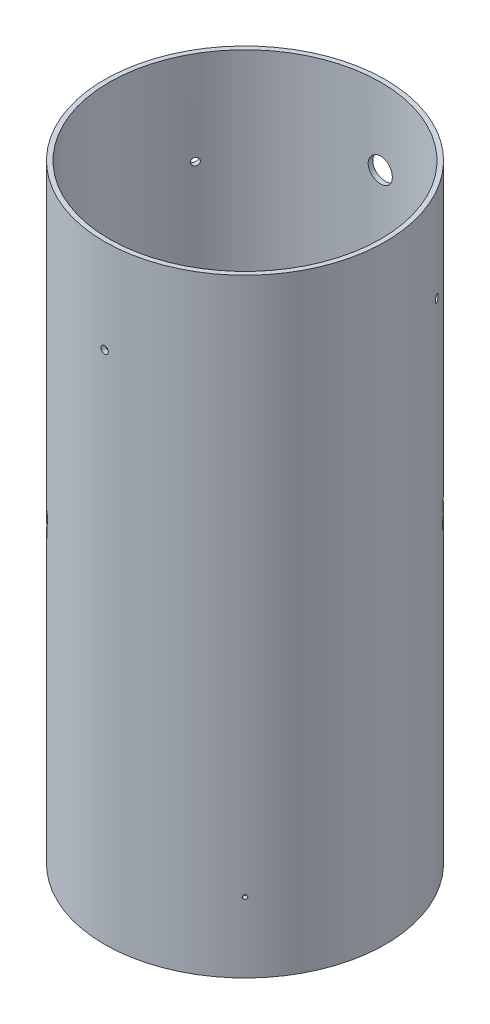
from build123d import *

# Parameters (mm, degrees)
SKETCH1_R                     = 76.1746
SKETCH1_R_2                   = 73.66
BOSS_EXTRUDE1_DEPTH           = 330.2
SKETCH23_R                    = 1.0922
SHEAR_SCRREWS_DEPTH           = 348.328633238
CIRPATTERN1_COUNT             = 4
CIRPATTERN2_COUNT             = 3
SKETCH26_R                    = 2.7499945
SKETCH26_W                    = 6.99999997
SKETCH26_H                    = 10.000000066
UPWARDS_CAMERA_CUTOUT_DEPTH   = 348.32863324
SKETCH27_R                    = 2.7499945
SKETCH27_W                    = 6.99999997
SKETCH27_H                    = 10.000000066
DOWNWARDS_CAMERA_CUTOUT_DEPTH = 348.32863324
SKETCH28_R                    = 2.7499945
CUT_EXTRUDE4_DEPTH            = 348.32863324
CIRPATTERN3_COUNT             = 2
CIRPATTERN3_ANGLE             = 8.407249505
SKETCH29_R                    = 2.7499945
CUT_EXTRUDE5_DEPTH            = 348.32863324
CIRPATTERN4_COUNT             = 2
CIRPATTERN4_ANGLE             = 8.407249505


with BuildPart() as part:
    # Sketch1 → Boss-Extrude1 (new body)
    with BuildSketch(Plane(origin=(0, 0, 0), x_dir=(1, 0, 0), z_dir=(0, 1, 0))):
        Circle(SKETCH1_R)
        Circle(SKETCH1_R_2, mode=Mode.SUBTRACT)
    extrude(amount=BOSS_EXTRUDE1_DEPTH)

    # Sketch17 → 1/2 Clearance Hole5 (revolve, cut)
    with BuildSketch(Plane(origin=(0, 288.925, 0), x_dir=(0, -1, 0), z_dir=(1, 0, 0))):
        Polygon((0, 0), (0, 80.134507437), (6.54812, 76.2), (6.54812, 0), align=None)
    revolve(axis=Axis((0, 288.925, 6.35), (0, 0, -1)), mode=Mode.SUBTRACT)

    # Sketch21 → 1/2 Clearance Hole7 (revolve, cut)
    with BuildSketch(Plane(origin=(0, 41.275, 0), x_dir=(0, -1, 0), z_dir=(1, 0, 0))):
        Polygon((0, 0), (0, 80.134507437), (6.54812, 76.2), (6.54812, 0), align=None)
    revolve(axis=Axis((0, 41.275, 6.35), (0, 0, -1)), mode=Mode.SUBTRACT)

    # Sketch23 → Shear Scrrews (cut, through all)
    with BuildSketch(Plane(origin=(0, 0, 0), x_dir=(0.7071067811865477, 0, 0.7071067811865475), z_dir=(-0.7071067811865475, 0, 0.7071067811865477))):
        with Locations((0, 38.1)):
            Circle(SKETCH23_R)
    shear_scrrews = extrude(amount=-SHEAR_SCRREWS_DEPTH, mode=Mode.SUBTRACT)

    # CirPattern1: Shear Scrrews ×4 about axis
    cirpattern1_axis = Axis((0, 330.2, 0), (0, -1, 0))
    for i in range(1, CIRPATTERN1_COUNT):
        add(shear_scrrews.rotate(cirpattern1_axis, i * 360 / CIRPATTERN1_COUNT), mode=Mode.SUBTRACT)

    # Sketch25 → Ø4.0 (4) Diameter Hole1 (revolve, cut)
    with BuildSketch(Plane(origin=(0, 279.4, 0), x_dir=(0, 1, 0), z_dir=(1, 0, 0))):
        Polygon((0, 0), (0, 90.101721238), (2, 88.9), (2, 0), align=None)
    f_4_0_4_diameter_hole1 = revolve(axis=Axis((0, 279.4, -6.35), (0, 0, 1)), mode=Mode.SUBTRACT)

    # CirPattern2: Ø4.0 (4) Diameter Hole1 ×3 about axis
    cirpattern2_axis = Axis((0, 330.2, 0), (0, 1, 0))
    for i in range(1, CIRPATTERN2_COUNT):
        add(f_4_0_4_diameter_hole1.rotate(cirpattern2_axis, i * 360 / CIRPATTERN2_COUNT), mode=Mode.SUBTRACT)

    # Sketch26 → Upwards Camera Cutout (cut, through all)
    with BuildSketch(Plane(origin=(0, 0, 0), x_dir=(0, -1, 0), z_dir=(0.7071067811865488, 0, -0.7071067811865464))):
        with Locations((-158.73500003, 0)):
            Circle(SKETCH26_R)
        with Locations((-171.125000015, 0)):
            Rectangle(SKETCH26_W, SKETCH26_H)
    extrude(amount=UPWARDS_CAMERA_CUTOUT_DEPTH, mode=Mode.SUBTRACT)

    # Sketch27 → Downwards Camera Cutout (cut, through all)
    with BuildSketch(Plane(origin=(0, 0, 0), x_dir=(0, -1, 0), z_dir=(0.7071067811865488, 0, -0.7071067811865464))):
        with Locations((-171.46499997, 0)):
            Circle(SKETCH27_R)
        with Locations((-159.074999985, 0)):
            Rectangle(SKETCH27_W, SKETCH27_H)
    extrude(amount=-DOWNWARDS_CAMERA_CUTOUT_DEPTH, mode=Mode.SUBTRACT)

    # Sketch28 → Cut-Extrude4 (cut, through all)
    with BuildSketch(Plane(origin=(0, 0, 0), x_dir=(0, -1, 0), z_dir=(0.7567196876815192, 0, -0.6537394850207414))):
        with Locations((-166.38499997, 0)):
            Circle(SKETCH28_R)
    cut_extrude4 = extrude(amount=-CUT_EXTRUDE4_DEPTH, mode=Mode.SUBTRACT)

    # CirPattern3: Cut-Extrude4 ×2 about axis
    cirpattern3_axis = Axis((0, 0, 0), (0, 1, 0))
    for i in range(1, CIRPATTERN3_COUNT):
        add(cut_extrude4.rotate(cirpattern3_axis, i * CIRPATTERN3_ANGLE / (CIRPATTERN3_COUNT - 1)), mode=Mode.SUBTRACT)

    # Sketch29 → Cut-Extrude5 (cut, through all)
    with BuildSketch(Plane(origin=(0, 0, 0), x_dir=(0, -1, 0), z_dir=(0.7567196876815192, 0, -0.6537394850207414))):
        with Locations((-163.81500003, 0)):
            Circle(SKETCH29_R)
    cut_extrude5 = extrude(amount=CUT_EXTRUDE5_DEPTH, mode=Mode.SUBTRACT)

    # CirPattern4: Cut-Extrude5 ×2 about axis
    cirpattern4_axis = Axis((0, 330.2, 0), (0, 1, 0))
    for i in range(1, CIRPATTERN4_COUNT):
        add(cut_extrude5.rotate(cirpattern4_axis, i * CIRPATTERN4_ANGLE / (CIRPATTERN4_COUNT - 1)), mode=Mode.SUBTRACT)


solid = part.part
